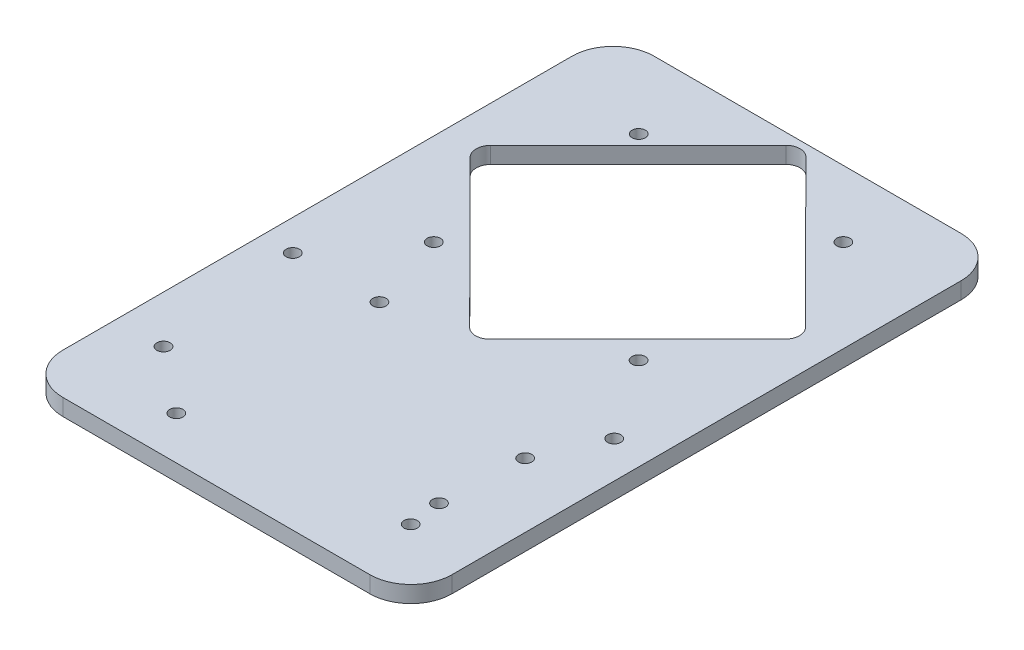
from build123d import *

# Parameters (mm, degrees)
SKETCH1_R           = 1.27
BOSS_EXTRUDE2_DEPTH = 3.175


with BuildPart() as part:
    # Sketch1 → Boss-Extrude2 (new body)
    with BuildSketch(Plane(origin=(0, 0, 0), x_dir=(1, 0, 0), z_dir=(0, 1, 0))):
        with BuildLine():
            Line((-117.135020463, 142.660762281), (-175.91562747, 142.657066645))
            ThreePointArc((-175.91562747, 142.657066645), (-181.458407426, 140.352437247), (-183.753097882, 134.805535228))
            Line((-183.753097882, 134.805535228), (-183.753097882, 37.366994908))
            ThreePointArc((-183.753097882, 37.366994908), (-181.461271413, 31.81826883), (-175.915621646, 29.519008442))
            Line((-175.915621646, 29.519008442), (-117.149118786, 29.519008442))
            ThreePointArc((-117.149118786, 29.519008442), (-111.597249567, 31.81866797), (-109.29759004, 37.37053719))
            Line((-109.29759004, 37.37053719), (-109.29759004, 134.809230866))
            ThreePointArc((-109.29759004, 134.809230866), (-111.588130828, 140.360246871), (-117.135020463, 142.660762281))
        make_face()
        with Locations((-174.718127663, 47.58354115)):
            Circle(SKETCH1_R, mode=Mode.SUBTRACT)
        with Locations((-162.435290361, 37.763153633)):
            Circle(SKETCH1_R, mode=Mode.SUBTRACT)
        with Locations((-177.85310358, 75.456747579)):
            Circle(SKETCH1_R, mode=Mode.SUBTRACT)
        with Locations((-161.416515799, 75.608057078)):
            Circle(SKETCH1_R, mode=Mode.SUBTRACT)
        with Locations((-121.602318574, 41.767430359)):
            Circle(SKETCH1_R, mode=Mode.SUBTRACT)
        with Locations((-122.379809257, 47.976111584)):
            Circle(SKETCH1_R, mode=Mode.SUBTRACT)
        with Locations((-121.602318573, 63.673415864)):
            Circle(SKETCH1_R, mode=Mode.SUBTRACT)
        with Locations((-116.329373394, 75.456747577)):
            Circle(SKETCH1_R, mode=Mode.SUBTRACT)
        with Locations((-166.159897821, 90.761182378)):
            Circle(SKETCH1_R, mode=Mode.SUBTRACT)
        with BuildLine():
            ThreePointArc((-176.801172002, 108.350518665), (-177.56091066, 110.280604208), (-176.798615575, 112.209681509))
            Line((-176.798615575, 112.209681509), (-148.531606371, 140.492813408))
            ThreePointArc((-148.531606371, 140.492813408), (-146.605093484, 141.290423511), (-144.679570761, 140.490425994))
            Line((-144.679570761, 140.490425994), (-116.447583058, 112.172218171))
            ThreePointArc((-116.447583058, 112.172218171), (-116.399310808, 112.122554806), (-116.352313283, 112.071683473))
            ThreePointArc((-116.352313283, 112.071683473), (-115.651459039, 110.172882818), (-116.449969407, 108.313038257))
            Line((-116.449969407, 108.313038257), (-144.71682032, 80.029903714))
            ThreePointArc((-144.71682032, 80.029903714), (-146.643487849, 79.232224846), (-148.569167296, 80.0322861))
            Line((-148.569167296, 80.0322861), (-176.801172002, 108.350518665))
        make_face(mode=Mode.SUBTRACT)
        with Locations((-164.472977249, 128.29201107)):
            Circle(SKETCH1_R, mode=Mode.SUBTRACT)
        with Locations((-126.972959075, 90.761489089)):
            Circle(SKETCH1_R, mode=Mode.SUBTRACT)
        with Locations((-126.972959073, 129.95775743)):
            Circle(SKETCH1_R, mode=Mode.SUBTRACT)
    extrude(amount=BOSS_EXTRUDE2_DEPTH)


solid = part.part
